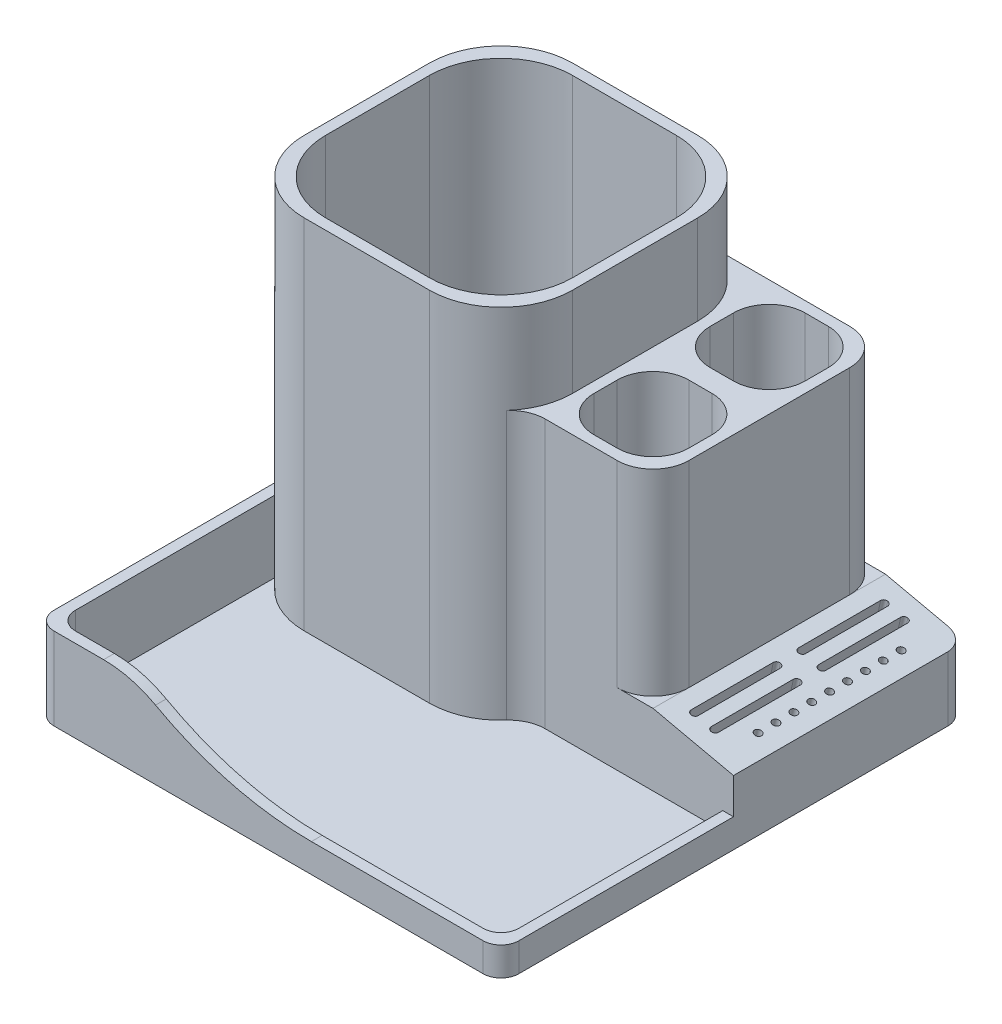
from build123d import *

# Parameters (mm, degrees)
EXTRUDE_1_DEPTH      = 3
EXTRUDE_2_DEPTH      = 100
SKETCH_3_W           = 26.5
SKETCH_3_H           = 26.50000000000003
SKETCH_3_W_2         = 26.500000000000004
SKETCH_3_H_2         = 26.5
EXTRUDE_3_DEPTH      = 75
FILLET_2_R           = 20
FILLET_3_R           = 20
FILLET_6_R           = 10
EXTRUDE_7_DEPTH      = 20
SKETCH_14_W          = 22.50000000000002
SKETCH_14_H          = 65
EXTRUDE_8_DEPTH      = 20
SKETCH_15_W          = 102.75181222829023
SKETCH_15_H          = 15
CUT_EXTRUDE_6_DEPTH  = 2.99999999999999
FILLET_7_R           = 90
FILLET_8_R           = 30
SKETCH_17_W          = 62.00000000000001
SKETCH_17_H          = 15
CUT_EXTRUDE_8_DEPTH  = 2.99999999999999
FILLET_9_R           = 5
FILLET_11_R          = 20
FILLET_12_R          = 20
FILLET_13_R          = 10
CUT_EXTRUDE_9_DEPTH  = 300
SKETCH_19_R          = 1.0000000000000018
SKETCH_19_R_2        = 1
SKETCH_19_R_3        = 1.0000000000000033
CUT_EXTRUDE_12_DEPTH = 18
SKETCH_19_4_W        = 2
SKETCH_19_4_H        = 25
SKETCH_19_4_W_2      = 2.0000000000000018
CUT_EXTRUDE_13_DEPTH = 20
FILLET_15_R          = 1


# Some blends are built 0.0001 mm under size
with BuildPart() as part:
    # Эскиз1 → Бобышка-Вытянуть1 (new body)
    with BuildSketch(Plane(origin=(0, 0, 0), x_dir=(1, 0, 0), z_dir=(0, 1, 0))):
        Polygon((0, 0), (-130, -1.837e-14), (-130, 129.99999999999997), (0, 130), align=None)
    extrude(amount=EXTRUDE_1_DEPTH)

    # Эскиз2 → Бобышка-Вытянуть2 (add)
    with BuildSketch(Plane(origin=(0, 3, 0), x_dir=(1, 0, 0), z_dir=(0, 1, 0))):
        Polygon((-130, 129.99999999999997), (-55.00000000000002, 130.0000000000001), (-55.00000000000002, 55.0000000000001), (-130.00000000000003, 55.0000000000001), align=None)
        Polygon((-127, 126.99999999999997), (-58.00000000000002, 127.00000000000009), (-58.000000000000014, 58.0000000000001), (-127.00000000000003, 58.00000000000009), align=None, mode=Mode.SUBTRACT)
    extrude(amount=EXTRUDE_2_DEPTH)

    # Эскиз3 → Бобышка-Вытянуть3 (add)
    # profile 1 of 2: a face of its own
    with BuildSketch(Plane(origin=(0, 3, 0), x_dir=(1, 0, 0), z_dir=(0, 1, 0))):
        Polygon((-22.50000000000002, 130), (-55.00000000000002, 130), (-55.00000000000002, 97.5), (-22.500000000000014, 97.5), align=None)
        with Locations((-38.75000000000002, 113.75)):
            Rectangle(SKETCH_3_W, SKETCH_3_H, mode=Mode.SUBTRACT)
    # profile 2 of 2: a face of its own
    with BuildSketch(Plane(origin=(0, 3, 0), x_dir=(1, 0, 0), z_dir=(0, 1, 0))):
        Polygon((-22.500000000000014, 97.5), (-55.00000000000002, 97.5), (-55.00000000000002, 65), (-22.5, 65), align=None)
        with Locations((-38.750000000000014, 81.25)):
            Rectangle(SKETCH_3_W_2, SKETCH_3_H_2, mode=Mode.SUBTRACT)
    extrude(amount=EXTRUDE_3_DEPTH)

    # Скругление2
    fillet_2_edges = [part.edges().sort_by_distance(p)[0] for p in [
        (-127, 53, -126.99999999999997),
        (-130, 51.5, -129.99999999999997),
    ]]
    fillet(fillet_2_edges, radius=FILLET_2_R)

    # Скругление3
    fillet_3_edges = [part.edges().sort_by_distance(p)[0] for p in [
        (-58.000000000000014, 53, -58.0000000000001),
        (-55.00000000000002, 53, -55.0000000000001),
        (-58.00000000000002, 53, -127.00000000000009),
        (-55.00000000000002, 90.5, -130.0000000000001),
    ]]
    fillet(fillet_3_edges, radius=FILLET_3_R)

    # Скругление6
    fillet_6_edges = [part.edges().sort_by_distance(p)[0] for p in [
        (-57.6794919243113, 40.5, -65),
        (-52.000000000000014, 40.5, -94.50000000000001),
        (-25.500000000000014, 40.5, -94.50000000000001),
        (-25.500000000000014, 40.5, -68),
        (-52.00000000000003, 40.5, -127),
        (-25.50000000000002, 40.5, -127),
        (-25.50000000000002, 40.5, -100.49999999999999),
        (-52.00000000000003, 40.5, -100.49999999999999),
        (-52.000000000000014, 40.5, -68),
    ]]
    fillet(fillet_6_edges, radius=FILLET_6_R)

    # Эскиз4 → Бобышка-Вытянуть7 (add)
    with BuildSketch(Plane(origin=(0, 3, 0), x_dir=(1, 0, 0), z_dir=(0, 1, 0))):
        Polygon((-3, 65), (-3, 2.999999999999999), (0, 2.999999999999982), (0, 65), align=None)
        Polygon((-3, 2.999999999999982), (-126.99999999999997, 2.999999999999982), (-126.99999999999997, -2.132e-14), (0, -1.721e-14), (0, 2.999999999999982), align=None)
        Polygon((-127, 55.0000000000001), (-130, 55.0000000000001), (-130, -1.421e-14), (-126.99999999999997, -1.837e-14), (-126.99999999999997, 2.9999999999999787), align=None)
    extrude(amount=EXTRUDE_7_DEPTH)

    # Эскиз14 → Бобышка-Вытянуть8 (add)
    with BuildSketch(Plane(origin=(0, 3, 0), x_dir=(1, 0, 0), z_dir=(0, 1, 0))):
        with Locations((-11.25000000000001, 97.5)):
            Rectangle(SKETCH_14_W, SKETCH_14_H)
    extrude(amount=EXTRUDE_8_DEPTH)

    # Эскиз15 → Вырез-Вытянуть6 (cut)
    with BuildSketch(Plane.XY):
        with Locations((-51.37590611414512, 15.5)):
            Rectangle(SKETCH_15_W, SKETCH_15_H)
    extrude(amount=-CUT_EXTRUDE_6_DEPTH, mode=Mode.SUBTRACT)

    # Скругление7
    # the kernel refuses this fillet: 90 mm, written as the material it adds along each edge
    with BuildSketch(Plane(origin=(-102.75181222829023, 8, 0), x_dir=(-9.5e-16, 1, 0), z_dir=(0, 0, -1))) as fillet_7_piece_1:
        with BuildLine():
            CenterArc((89.99999999999996, 49.74937185533107), FILLET_7_R, 180.00000000000006, 33.55730976192069)
            Line((-4.713e-14, 49.749371855330985), (-1.800000000000047, 49.749371855330985))
            Line((-1.800000000000047, 49.749371855330985), (-1.7999999999999998, -1.71e-15))
            Line((-1.7999999999999998, -1.71e-15), (1.71e-15, -1.7999999999999972))
            ThreePointArc((1.71e-15, -1.7999999999999972), (7.499999999999995, -1.79999999999999), (13.499999999999988, -0.9949874371066173))
            Line((13.499999999999988, -0.9949874371066173), (14.999999999999986, 0))
        make_face()
    extrude(amount=2.99999999999999)

    # Скругление8
    fillet_8_edges = [part.edges().sort_by_distance(p)[0] for p in [
        (-102.75181222829023, 23, -1.499999999999995),
    ]]
    fillet(fillet_8_edges, radius=FILLET_8_R)

    # Эскиз17 → Вырез-Вытянуть8 (cut)
    with BuildSketch(Plane(origin=(0, 0, 0), x_dir=(0, 0, -1), z_dir=(1, 0, 0))):
        with Locations((33.99999999999999, 15.5)):
            Rectangle(SKETCH_17_W, SKETCH_17_H)
    extrude(amount=-CUT_EXTRUDE_8_DEPTH, mode=Mode.SUBTRACT)

    # Скругление9
    fillet_9_edges = [part.edges().sort_by_distance(p)[0] for p in [
        (-126.99999999999997, 13, -2.9999999999999805),
        (-3, 5.5, -2.9999999999999902),
        (0, 4, 2.99e-15),
        (-130, 11.5, 1.704e-14),
        (0, 11.5, -130),
    ]]
    fillet(fillet_9_edges, radius=FILLET_9_R)

    # Скругление11
    fillet_11_edges = [part.edges().sort_by_distance(p)[0] for p in [
        (-127.00000000000003, 53, -58.00000000000009),
    ]]
    fillet(fillet_11_edges, radius=FILLET_11_R)

    # Скругление12
    fillet_12_edges = [part.edges().sort_by_distance(p)[0] for p in [
        (-130.00000000000003, 63, -55.0000000000001),
    ]]
    fillet(fillet_12_edges, radius=FILLET_12_R)

    # Скругление13
    fillet_13_edges = [part.edges().sort_by_distance(p)[0] for p in [
        (-22.5, 50.5, -65),
        (-22.50000000000002, 50.5, -130),
    ]]
    fillet(fillet_13_edges, radius=FILLET_13_R)

    # Эскиз18 → Вырез-Вытянуть9 (cut)
    with BuildSketch(Plane.XY.offset(-65)):
        Polygon((-22.50000000000001, 22.999999999999993), (0, 18), (0, 23), align=None)
    extrude(amount=-CUT_EXTRUDE_9_DEPTH, mode=Mode.SUBTRACT)

    # Эскиз19 → Вырез-Вытянуть12 (cut)
    with BuildSketch(Plane(origin=(3.811764705882347, 17.15294117647059, 0), x_dir=(0.9761870601839528, -0.2169304578186562, 0), z_dir=(0.2169304578186562, 0.9761870601839528, 0))):
        with Locations(Location((-9.666963526543862, 102.5, 0), (0, 0, 180))):
            Circle(SKETCH_19_R)
        with Locations(Location((-9.666963526543864, 107.5, 0), (0, 0, 180))):
            Circle(SKETCH_19_R_2)
        with Locations(Location((-9.666963526543864, 112.49999999999999, 0), (0, 0, 180))):
            Circle(SKETCH_19_R_2)
        with Locations(Location((-9.666963526543865, 117.49999999999999, 0), (0, 0, 180))):
            Circle(SKETCH_19_R)
        with Locations(Location((-9.666963526543862, 97.5, 0), (0, 0, 180))):
            Circle(SKETCH_19_R)
        with Locations(Location((-9.666963526543793, 92.50000000000001, 0), (0, 0, 180))):
            Circle(SKETCH_19_R)
        with Locations(Location((-9.666963526543721, 87.50000000000001, 0), (0, 0, 180))):
            Circle(SKETCH_19_R_2)
        with Locations(Location((-9.666963526543652, 82.50000000000001, 0), (0, 0, 180))):
            Circle(SKETCH_19_R_3)
        with Locations(Location((-9.66696352654358, 77.50000000000003, 0), (0, 0, 180))):
            Circle(SKETCH_19_R)
    extrude(amount=-CUT_EXTRUDE_12_DEPTH, mode=Mode.SUBTRACT)

    # Эскиз19<4> → Вырез-Вытянуть13 (cut)
    with BuildSketch(Plane(origin=(3.811764705882347, 17.15294117647059, 0), x_dir=(0.9761870601839528, -0.2169304578186562, 0), z_dir=(0.2169304578186562, 0.9761870601839528, 0))):
        Polygon((-22.191394098159968, 125.00000000000003), (-22.191394098159964, 100), (-20.191394098159968, 100), (-20.19139409815997, 125.00000000000003), align=None)
        Polygon((-20.191394098159975, 95.00000000000003), (-20.19139409815997, 70), (-22.191394098159968, 70), (-22.19139409815997, 95.00000000000003), align=None)
        with Locations((-15.429178812351914, 112.50000000000001)):
            Rectangle(SKETCH_19_4_W, SKETCH_19_4_H)
        with Locations((-15.429178812351918, 82.5)):
            Rectangle(SKETCH_19_4_W_2, SKETCH_19_4_H)
    extrude(amount=-CUT_EXTRUDE_13_DEPTH, mode=Mode.SUBTRACT)

    # Скругление15
    fillet_15_edges = [part.edges().sort_by_distance(p)[0] for p in [
        (-14.395491638370515, 10.95505985597913, -100),
        (-20.020491638370512, 12.205059855979126, -100),
        (-14.395491638370515, 10.95505985597913, -125),
        (-20.020491638370515, 12.20505985597913, -125.00000000000003),
        (-18.068117518002612, 11.771198940341815, -100),
        (-12.44311751800261, 10.521198940341815, -100),
        (-12.44311751800261, 10.521198940341815, -125),
        (-18.068117518002612, 11.771198940341815, -125.00000000000003),
        (-12.443117518002612, 10.521198940341815, -95),
        (-18.068117518002616, 11.771198940341819, -95.00000000000003),
        (-14.395491638370519, 10.95505985597913, -95),
        (-20.02049163837052, 12.20505985597913, -95.00000000000003),
        (-12.443117518002612, 10.521198940341815, -70),
        (-18.068117518002612, 11.771198940341815, -70),
        (-14.395491638370519, 10.95505985597913, -70),
        (-20.020491638370515, 12.20505985597913, -70),
    ]]
    fillet(fillet_15_edges, radius=FILLET_15_R - 0.0001)  # a hair under: the kernel refuses the full size


solid = part.part
